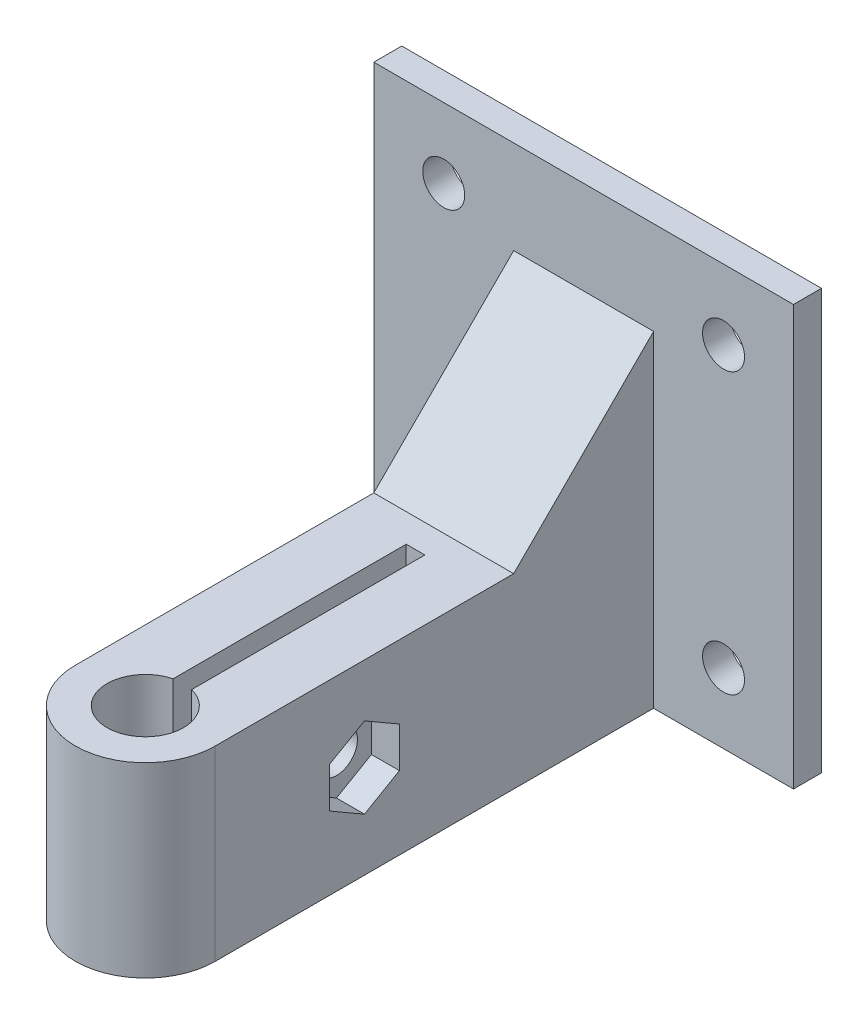
from build123d import *

# Parameters (mm, degrees)
SKETCH1_W           = 45
SKETCH1_H           = 45
SKETCH1_R           = 2.25
BOSS_EXTRUDE1_DEPTH = 3
BOSS_EXTRUDE2_DEPTH = 20
CHAMFER1_SIZE       = 15
SKETCH4_R           = 2.25
CUT_EXTRUDE1_DEPTH  = 20
CUT_EXTRUDE2_DEPTH  = 3


with BuildPart() as part:
    # Sketch1 → Boss-Extrude1 (new body)
    with BuildSketch(Plane.XY):
        Rectangle(SKETCH1_W, SKETCH1_H)
        with Locations((-15, 15)):
            Circle(SKETCH1_R, mode=Mode.SUBTRACT)
        with Locations((15, 15)):
            Circle(SKETCH1_R, mode=Mode.SUBTRACT)
        with Locations((15, -15)):
            Circle(SKETCH1_R, mode=Mode.SUBTRACT)
        with Locations((-15, -15)):
            Circle(SKETCH1_R, mode=Mode.SUBTRACT)
    extrude(amount=BOSS_EXTRUDE1_DEPTH)

    # Sketch3 → Boss-Extrude2 (add)
    with BuildSketch(Plane(origin=(0, -22.5, 0), x_dir=(-1, 0, 0), z_dir=(0, -1, 0))):
        with BuildLine():
            Line((7.5, -3), (-7.5, -3))
            Line((-7.5, -3), (-7.5, -50))
            ThreePointArc((-7.5, -50), (0, -57.5), (7.5, -50))
            Line((7.5, -50), (7.5, -3))
        make_face()
        with BuildLine():
            Line((1, -46.02382093), (1, -21.02382093))
            Line((1, -21.02382093), (-1, -21.02382093))
            Line((-1, -21.02382093), (-1, -46.02382093))
            ThreePointArc((-1, -46.02382093), (0, -54.1), (1, -46.02382093))
        make_face(mode=Mode.SUBTRACT)
    extrude(amount=-BOSS_EXTRUDE2_DEPTH)

    # Chamfer1
    chamfer1_edges = [part.edges().sort_by_distance(p)[0] for p in [
        (0, -2.5, 3),
    ]]
    chamfer(chamfer1_edges, length=CHAMFER1_SIZE)

    # Sketch4 → Cut-Extrude1 (cut)
    with BuildSketch(Plane.ZY.offset(7.5)):
        with Locations((34, -12.5)):
            Circle(SKETCH4_R)
    extrude(amount=-CUT_EXTRUDE1_DEPTH, mode=Mode.SUBTRACT)

    # Sketch5 → Cut-Extrude2 (cut)
    with BuildSketch(Plane(origin=(7.5, 0, 0), x_dir=(0, 0, -1), z_dir=(1, 0, 0))):
        Polygon((-34, -16.830127019), (-30.25, -14.665063509), (-30.25, -10.334936491), (-34, -8.169872981), (-37.75, -10.334936491), (-37.75, -14.665063509), align=None)
    extrude(amount=-CUT_EXTRUDE2_DEPTH, mode=Mode.SUBTRACT)


solid = part.part
